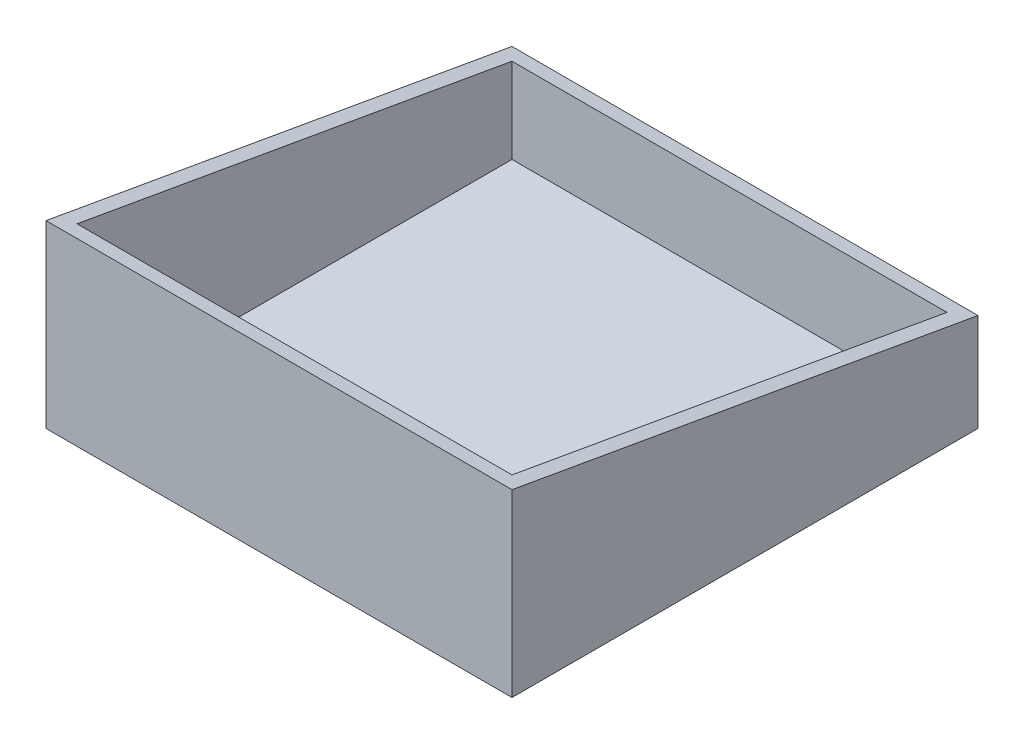
from build123d import *

# Parameters (mm, degrees)
BOSS_EXTRUDE1_DEPTH = 381
SHELL1_T            = -12.7


with BuildPart() as part:
    # Sketch1 → Boss-Extrude1 (new body)
    with BuildSketch(Plane(origin=(0, 0, 0), x_dir=(0, 0, -1), z_dir=(1, 0, 0))):
        Polygon((0, 0), (381, 0), (381, 80), (0, 147.18057965), align=None)
    extrude(amount=BOSS_EXTRUDE1_DEPTH)

    # Shell1
    shell1_openings = [part.faces().sort_by_distance(p)[0] for p in [
        (190.5, 113.590289825, -190.5),
    ]]
    offset(amount=SHELL1_T, openings=shell1_openings, kind=Kind.INTERSECTION)


solid = part.part
